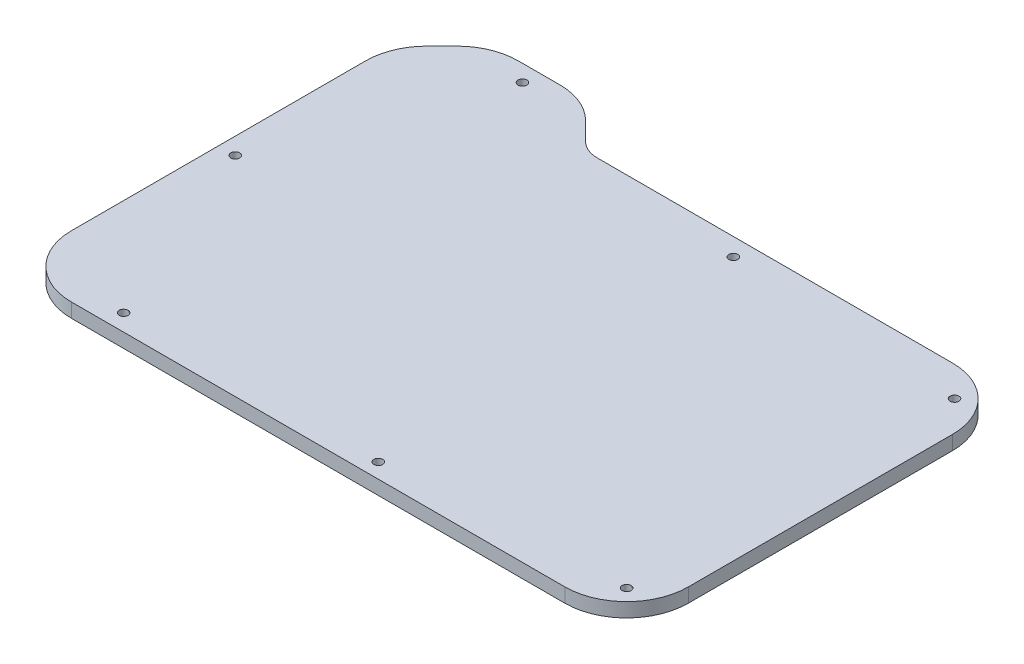
from build123d import *

# Parameters (mm, degrees)
SKETCH1_R           = 1
BOSS_EXTRUDE1_DEPTH = 3.175


with BuildPart() as part:
    # Sketch1 → Boss-Extrude1 (new body)
    with BuildSketch(Plane(origin=(0, 0, 0), x_dir=(1, 0, 0), z_dir=(0, 1, 0))):
        with BuildLine():
            Line((-185.141640917, -125.238822309), (-74.40680055, -125.238822309))
            ThreePointArc((-74.40680055, -125.238822309), (-64.613371631, -121.182251229), (-60.55680055, -111.388822309))
            Line((-60.55680055, -111.388822309), (-60.55680055, -52.088822309))
            ThreePointArc((-60.55680055, -52.088822309), (-64.613371631, -42.29539339), (-74.40680055, -38.238822309))
            Line((-74.40680055, -38.238822309), (-154.131268799, -38.238822309))
            ThreePointArc((-154.131268799, -38.238822309), (-156.561308595, -37.755457341), (-158.62139686, -36.37895037))
            Line((-158.62139686, -36.37895037), (-162.70495384, -32.29539339))
            ThreePointArc((-162.70495384, -32.29539339), (-167.198217221, -29.293090784), (-172.498382759, -28.238822309))
            Line((-172.498382759, -28.238822309), (-181.861384796, -28.238822309))
            ThreePointArc((-181.861384796, -28.238822309), (-187.161550334, -29.293090784), (-191.654813716, -32.29539339))
            Line((-191.654813716, -32.29539339), (-194.935069837, -35.575649511))
            ThreePointArc((-194.935069837, -35.575649511), (-197.937372442, -40.068912892), (-198.991640917, -45.36907843))
            Line((-198.991640917, -45.36907843), (-198.991640917, -111.388822309))
            ThreePointArc((-198.991640917, -111.388822309), (-194.935069837, -121.182251229), (-185.141640917, -125.238822309))
        make_face()
        with Locations((-67.26502206, -44.947043819)):
            Circle(SKETCH1_R, mode=Mode.SUBTRACT)
        with Locations((-67.26502206, -118.530600799)):
            Circle(SKETCH1_R, mode=Mode.SUBTRACT)
        with Locations((-119.628115963, -121.884711554)):
            Circle(SKETCH1_R, mode=Mode.SUBTRACT)
        with Locations((-177.179883778, -121.488822309)):
            Circle(SKETCH1_R, mode=Mode.SUBTRACT)
        with Locations((-195.241640917, -78.37895037)):
            Circle(SKETCH1_R, mode=Mode.SUBTRACT)
        with Locations((-177.179883778, -31.988822309)):
            Circle(SKETCH1_R, mode=Mode.SUBTRACT)
        with Locations((-119.628115963, -42.209793178)):
            Circle(SKETCH1_R, mode=Mode.SUBTRACT)
    extrude(amount=BOSS_EXTRUDE1_DEPTH)


solid = part.part
